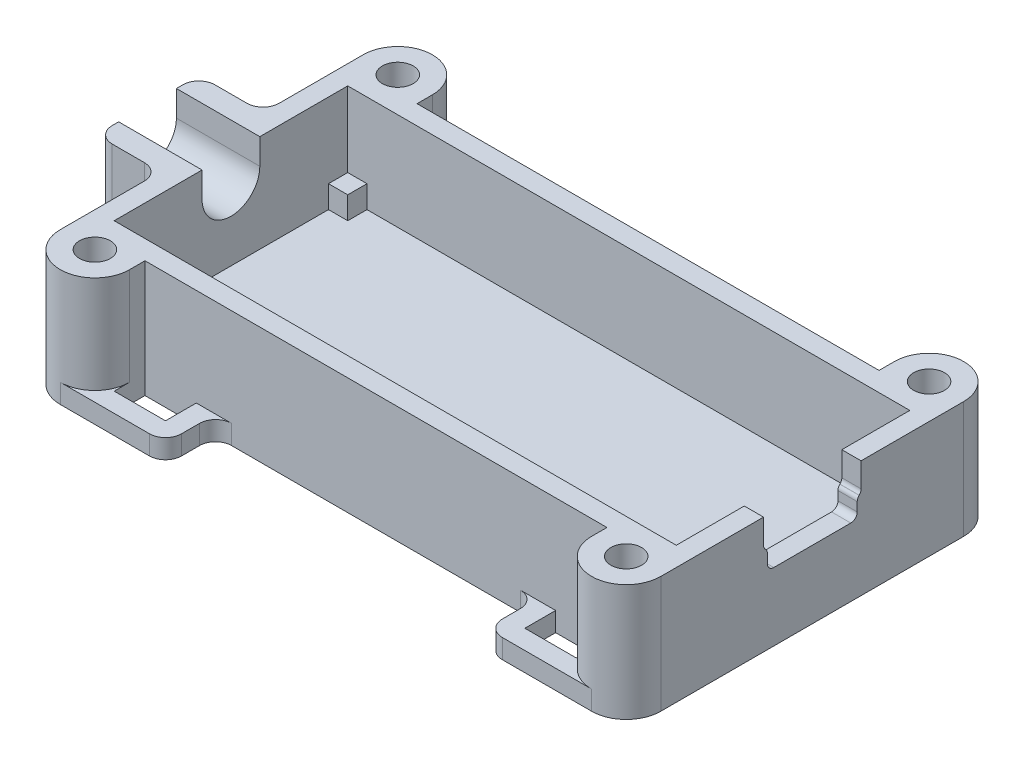
from build123d import *

# Parameters (mm, degrees)
SKETCH1_W           = 43.8
SKETCH1_H           = 18.2
SKETCH1_R           = 1.2
BOSS_EXTRUDE1_DEPTH = 7.6
BOSS_EXTRUDE2_START = 1.5
SKETCH3_R           = 1.2
BOSS_EXTRUDE2_DEPTH = 1.5
CUT_EXTRUDE1_REACH  = 56.325
SKETCH5_W           = 1.5
SKETCH5_H           = 1.5
BOSS_EXTRUDE3_DEPTH = 1.75
CUT_EXTRUDE2_REACH  = 56.325
BOSS_EXTRUDE4_DEPTH = 1.5
FILLET1_R           = 1.25
FILLET2_R           = 0.5


with BuildPart() as part:
    # Sketch1 → Boss-Extrude1 (new body)
    with BuildSketch(Plane(origin=(0, 0, 0), x_dir=(1, 0, 0), z_dir=(0, 1, 0))):
        with BuildLine():
            Line((-23.4, -4), (-23.4, -11.8))
            ThreePointArc((-23.4, -11.8), (-20.7, -14.5), (-18, -11.8))
            Line((-18, -11.8), (-18, -10.6))
            Line((-18, -10.6), (18, -10.6))
            Line((18, -10.6), (18, -11.8))
            ThreePointArc((18, -11.8), (20.7, -14.5), (23.4, -11.8))
            Line((23.4, -11.8), (23.4, 11.8))
            ThreePointArc((23.4, 11.8), (20.7, 14.5), (18, 11.8))
            Line((18, 11.8), (18, 10.6))
            Line((18, 10.6), (-18, 10.6))
            Line((-18, 10.6), (-18, 11.8))
            ThreePointArc((-18, 11.8), (-20.7, 14.5), (-23.4, 11.8))
            Line((-23.4, 11.8), (-23.4, 4))
            Line((-23.4, 4), (-28.4, 4))
            Line((-28.4, 4), (-28.4, -4))
            Line((-28.4, -4), (-23.4, -4))
        make_face()
        Rectangle(SKETCH1_W, SKETCH1_H, mode=Mode.SUBTRACT)
        with Locations((-20.7, -11.8)):
            Circle(SKETCH1_R, mode=Mode.SUBTRACT)
        with Locations((-20.7, 11.8)):
            Circle(SKETCH1_R, mode=Mode.SUBTRACT)
        with Locations((20.7, -11.8)):
            Circle(SKETCH1_R, mode=Mode.SUBTRACT)
        with Locations((20.7, 11.8)):
            Circle(SKETCH1_R, mode=Mode.SUBTRACT)
    extrude(amount=BOSS_EXTRUDE1_DEPTH)

    # Sketch3 → Boss-Extrude2 (add)
    with BuildSketch(Plane.XZ.offset(BOSS_EXTRUDE2_START)):
        with BuildLine():
            Line((-23.4, -4), (-23.4, -11.8))
            ThreePointArc((-23.4, -11.8), (-20.7, -14.5), (-18, -11.8))
            Line((-18, -11.8), (-18, -10.6))
            Line((-18, -10.6), (18, -10.6))
            Line((18, -10.6), (18, -11.8))
            ThreePointArc((18, -11.8), (20.7, -14.5), (23.4, -11.8))
            Line((23.4, -11.8), (23.4, 11.8))
            ThreePointArc((23.4, 11.8), (20.7, 14.5), (18, 11.8))
            Line((18, 11.8), (18, 10.6))
            Line((18, 10.6), (-18, 10.6))
            Line((-18, 10.6), (-18, 11.8))
            ThreePointArc((-18, 11.8), (-20.7, 14.5), (-23.4, 11.8))
            Line((-23.4, 11.8), (-23.4, 4))
            Line((-23.4, 4), (-28.4, 4))
            Line((-28.4, 4), (-28.4, -4))
            Line((-28.4, -4), (-23.4, -4))
        make_face()
        with Locations((-20.7, -11.8)):
            Circle(SKETCH3_R, mode=Mode.SUBTRACT)
        with Locations((20.7, -11.8)):
            Circle(SKETCH3_R, mode=Mode.SUBTRACT)
        with Locations((20.7, 11.8)):
            Circle(SKETCH3_R, mode=Mode.SUBTRACT)
        with Locations((-20.7, 11.8)):
            Circle(SKETCH3_R, mode=Mode.SUBTRACT)
    extrude(amount=-BOSS_EXTRUDE2_DEPTH)

    # Sketch4 → Cut-Extrude1 (cut, up to next)
    with BuildSketch(Plane.ZY.offset(28.4), mode=Mode.PRIVATE) as cut_extrude1_sk1:
        with BuildLine():
            Line((-2.25, 7.6), (-2.25, 5.6))
            ThreePointArc((-2.25, 5.6), (0, 3.35), (2.25, 5.6))
            Line((2.25, 5.6), (2.25, 7.6))
            Line((2.25, 7.6), (-2.25, 7.6))
        make_face()
    cut_extrude1_tool1 = extrude(cut_extrude1_sk1.sketch, amount=-CUT_EXTRUDE1_REACH, mode=Mode.PRIVATE) & part.part
    add(cut_extrude1_tool1.solids().sort_by_distance((-28.4, 5.682954, 0))[0], mode=Mode.SUBTRACT)

    # Sketch5 → Boss-Extrude3 (add)
    with BuildSketch(Plane(origin=(0, 0, 0), x_dir=(1, 0, 0), z_dir=(0, 1, 0))):
        with Locations((-21.15, 8.35)):
            Rectangle(SKETCH5_W, SKETCH5_H)
        with Locations((21.15, 8.35)):
            Rectangle(SKETCH5_W, SKETCH5_H)
        with Locations((-21.15, -8.35)):
            Rectangle(SKETCH5_W, SKETCH5_H)
        with Locations((21.15, -8.35)):
            Rectangle(SKETCH5_W, SKETCH5_H)
    extrude(amount=BOSS_EXTRUDE3_DEPTH)

    # Sketch6 → Cut-Extrude2 (cut, up to next)
    with BuildSketch(Plane(origin=(23.4, 0, 0), x_dir=(0, 0, -1), z_dir=(1, 0, 0)), mode=Mode.PRIVATE) as cut_extrude2_sk1:
        Polygon((3.8, 7.6), (-3.8, 7.6), (-3.8, 5.5), (-3.5, 5.2), (-3.5, 3.8), (3.5, 3.8), (3.5, 5.2), (3.8, 5.5), align=None)
    cut_extrude2_tool1 = extrude(cut_extrude2_sk1.sketch, amount=-CUT_EXTRUDE2_REACH, mode=Mode.PRIVATE) & part.part
    add(cut_extrude2_tool1.solids().sort_by_distance((23.4, 5.737352, 0))[0], mode=Mode.SUBTRACT)

    # Sketch8 → Boss-Extrude4 (add)
    with BuildSketch(Plane.XZ.offset(1.5)):
        with BuildLine():
            Line((12.5, 14.5), (12.5, 10.6))
            Line((12.5, 10.6), (14, 10.6))
            Line((14, 10.6), (14, 13))
            Line((14, 13), (18, 13))
            Line((18, 13), (18, 11.8))
            ThreePointArc((18, 11.8), (18.790811691, 13.709188309), (20.7, 14.5))
            Line((20.7, 14.5), (12.5, 14.5))
        make_face()
        with BuildLine():
            Line((-12.5, 14.5), (-20.7, 14.5))
            ThreePointArc((-20.7, 14.5), (-18.790811691, 13.709188309), (-18, 11.8))
            Line((-18, 11.8), (-18, 13))
            Line((-18, 13), (-14, 13))
            Line((-14, 13), (-14, 10.6))
            Line((-14, 10.6), (-12.5, 10.6))
            Line((-12.5, 10.6), (-12.5, 14.5))
        make_face()
        with BuildLine():
            Line((-20.7, -14.5), (-12.5, -14.5))
            Line((-12.5, -14.5), (-12.5, -10.6))
            Line((-12.5, -10.6), (-14, -10.6))
            Line((-14, -10.6), (-14, -13))
            Line((-14, -13), (-18, -13))
            Line((-18, -13), (-18, -11.8))
            ThreePointArc((-18, -11.8), (-18.790811691, -13.709188309), (-20.7, -14.5))
        make_face()
        with BuildLine():
            Line((14, -10.6), (12.5, -10.6))
            Line((12.5, -10.6), (12.5, -14.5))
            Line((12.5, -14.5), (20.7, -14.5))
            ThreePointArc((20.7, -14.5), (18.790811691, -13.709188309), (18, -11.8))
            Line((18, -11.8), (18, -13))
            Line((18, -13), (14, -13))
            Line((14, -13), (14, -10.6))
        make_face()
    extrude(amount=-BOSS_EXTRUDE4_DEPTH)

    # Fillet1
    fillet1_edges = [part.edges().sort_by_distance(p)[0] for p in [
        (-28.4, 3.05, 4),
        (-28.4, 3.05, -4),
        (-23.4, 3.05, -4),
        (-23.4, 3.05, 4),
        (-12.5, -0.75, -10.6),
        (-12.5, -0.75, -14.5),
        (12.5, -0.75, -14.5),
        (12.5, -0.75, -10.6),
        (12.5, -0.75, 14.5),
        (12.5, -0.75, 10.6),
        (-12.5, -0.75, 10.6),
        (-12.5, -0.75, 14.5),
    ]]
    fillet(fillet1_edges, radius=FILLET1_R)

    # Fillet2
    fillet2_edges = [part.edges().sort_by_distance(p)[0] for p in [
        (22.65, 3.8, 3.5),
        (22.65, 3.8, -3.5),
        (22.65, 5.2, -3.5),
        (22.65, 5.5, -3.8),
        (22.65, 5.2, 3.5),
        (22.65, 5.5, 3.8),
    ]]
    fillet(fillet2_edges, radius=FILLET2_R)


solid = part.part
